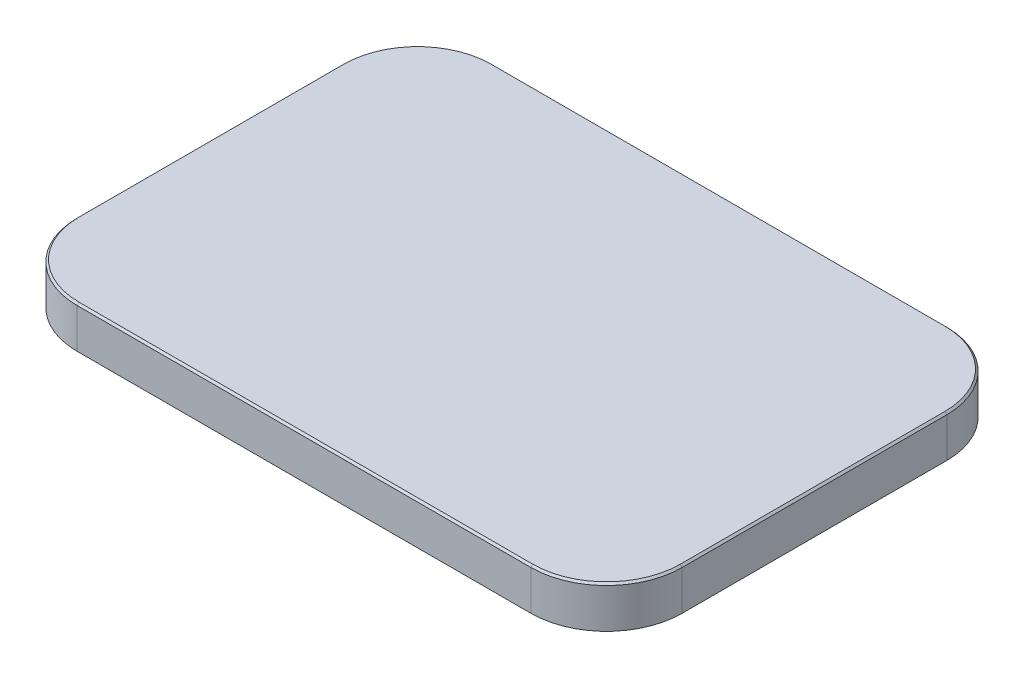
from build123d import *

# Parameters (mm, degrees)
SKETCH1_W           = 160
SKETCH1_H           = 110
BOSS_EXTRUDE1_DEPTH = 1
FILLET1_R           = 20
BOSS_EXTRUDE2_START = 10
BOSS_EXTRUDE2_DEPTH = 10
FILLET2_R           = 0.4
CHAMFER1_SIZE       = 0.5


with BuildPart() as part:
    # Sketch1 → Boss-Extrude1 (new body)
    with BuildSketch(Plane(origin=(0, 0, 0), x_dir=(1, 0, 0), z_dir=(0, 1, 0))):
        Rectangle(SKETCH1_W, SKETCH1_H)
    extrude(amount=-BOSS_EXTRUDE1_DEPTH)

    # Fillet1
    fillet1_edges = [part.edges().sort_by_distance(p)[0] for p in [
        (80, -0.5, -55),
        (80, -0.5, 55),
        (-80, -0.5, 55),
        (-80, -0.5, -55),
    ]]
    fillet(fillet1_edges, radius=FILLET1_R)

    # Sketch2 → Boss-Extrude2 (add)
    with BuildSketch(Plane.XZ.offset(1).offset(BOSS_EXTRUDE2_START)):
        with BuildLine():
            Line((-60, -55), (60, -55))
            ThreePointArc((60, -55), (74.142135624, -49.142135624), (80, -35))
            Line((80, -35), (80, 35))
            ThreePointArc((80, 35), (74.142135624, 49.142135624), (60, 55))
            Line((60, 55), (-60, 55))
            ThreePointArc((-60, 55), (-74.142135624, 49.142135624), (-80, 35))
            Line((-80, 35), (-80, -35))
            ThreePointArc((-80, -35), (-74.142135624, -49.142135624), (-60, -55))
        make_face()
        with BuildLine():
            Line((-79, 35), (-79, -35))
            ThreePointArc((-79, -35), (-73.435028843, -48.435028843), (-60, -54))
            Line((-60, -54), (60, -54))
            ThreePointArc((60, -54), (73.435028843, -48.435028843), (79, -35))
            Line((79, -35), (79, 35))
            ThreePointArc((79, 35), (73.435028843, 48.435028843), (60, 54))
            Line((60, 54), (-60, 54))
            ThreePointArc((-60, 54), (-73.435028843, 48.435028843), (-79, 35))
        make_face(mode=Mode.SUBTRACT)
    extrude(amount=-BOSS_EXTRUDE2_DEPTH)

    # Fillet2
    fillet2_edges = [part.edges().sort_by_distance(p)[0] for p in [
        (73.435028843, -1, 48.435028843),
        (79, -1, 0),
        (73.435028843, -1, -48.435028843),
        (0, -1, -54),
        (-73.435028843, -1, -48.435028843),
        (-79, -1, 0),
        (-73.435028843, -1, 48.435028843),
        (0, -1, 54),
    ]]
    fillet(fillet2_edges, radius=FILLET2_R)

    # Chamfer1
    chamfer1_edges = [part.edges().sort_by_distance(p)[0] for p in [
        (0, 0, 55),
        (-74.142135624, 0, 49.142135624),
        (74.142135624, 0, 49.142135624),
        (-80, 0, 0),
        (80, 0, 0),
        (-74.142135624, 0, -49.142135624),
        (74.142135624, 0, -49.142135624),
        (0, 0, -55),
    ]]
    chamfer(chamfer1_edges, length=CHAMFER1_SIZE)


solid = part.part
